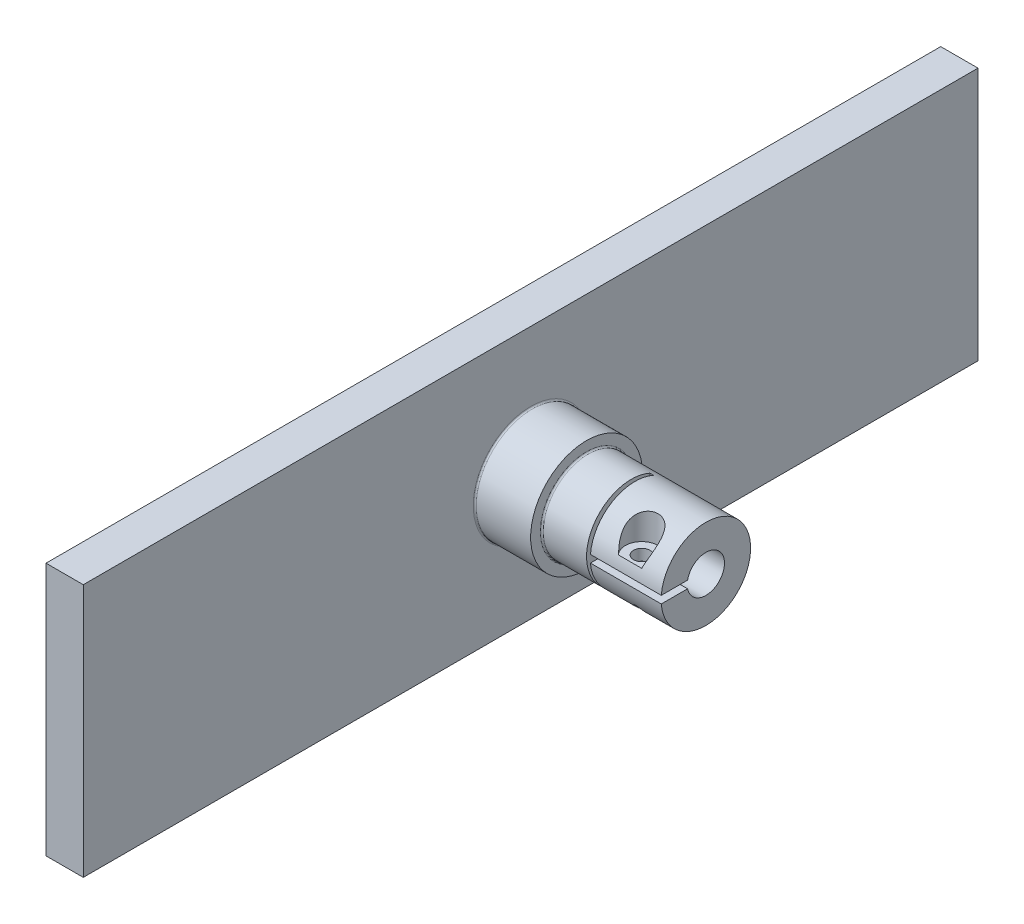
from build123d import *

# Parameters (mm, degrees)
SKETCH1_W                                     = 120
SKETCH1_H                                     = 34
BOSS_EXTRUDE1_DEPTH                           = 5
BOSS_EXTRUDE2_DEPTH                           = 7.5
SKETCH3_R                                     = 6
BOSS_EXTRUDE3_DEPTH                           = 16
CUT_EXTRUDE1_DEPTH                            = 9.5
SKETCH5_W                                     = 0.5
SKETCH5_H                                     = 12
CUT_EXTRUDE2_DEPTH                            = 8.5
CBORE_START                                   = 19
CBORE_FOR_M2_HEX_SOCKET_HEAD_CAP_SCREW1_DEPTH = 3.691221609
CBORE_START_2                                 = 17.5
CBORE_FOR_M2_HEX_SOCKET_HEAD_CAP_SCR_3_O_R    = 1.1
CBORE_FOR_M2_HEX_SOCKET_HEAD_CAP_SCR_3_DEPTH  = 1.5
M2_TAPPED_HOLE1_D                             = 1.6
FILLET1_R                                     = 0.2


# Read off the part's stored shape, not the designer's step: CBORE for M2 Hex Socket Head Cap Screw1
with BuildPart() as part:
    # Sketch1 → Boss-Extrude1 (new body)
    with BuildSketch(Plane(origin=(0, 0, 0), x_dir=(0, 0, -1), z_dir=(1, 0, 0))):
        with Locations((-60, 17)):
            Rectangle(SKETCH1_W, SKETCH1_H)
    extrude(amount=BOSS_EXTRUDE1_DEPTH)

    # Sketch2 → Boss-Extrude2 (add)
    with BuildSketch(Plane(origin=(5, 0, 0), x_dir=(0, 0, -1), z_dir=(1, 0, 0))):
        with BuildLine():
            ThreePointArc((-52.5, 17), (-54.696699141, 22.303300859), (-60, 24.5))
            Line((-60, 24.5), (-60, 9.5))
            ThreePointArc((-60, 9.5), (-54.696699141, 11.696699141), (-52.5, 17))
        make_face()
        with BuildLine():
            Line((-60, 9.5), (-60, 24.5))
            ThreePointArc((-60, 24.5), (-67.5, 17), (-60, 9.5))
        make_face()
    extrude(amount=BOSS_EXTRUDE2_DEPTH)

    # Sketch3 → Boss-Extrude3 (add)
    with BuildSketch(Plane(origin=(12.5, 0, 0), x_dir=(0, 0, -1), z_dir=(1, 0, 0))):
        with Locations((-60, 17)):
            Circle(SKETCH3_R)
    extrude(amount=BOSS_EXTRUDE3_DEPTH)

    # Sketch4 → Cut-Extrude1 (cut)
    with BuildSketch(Plane(origin=(28.5, 0, 0), x_dir=(0, 0, -1), z_dir=(1, 0, 0))):
        with BuildLine():
            Line((-62.449489743, 17.5), (-67.449489743, 17.5))
            Line((-67.449489743, 17.5), (-67.449489743, 16.5))
            Line((-67.449489743, 16.5), (-62.449489743, 16.5))
            ThreePointArc((-62.449489743, 16.5), (-57.5, 17), (-62.449489743, 17.5))
        make_face()
    extrude(amount=-CUT_EXTRUDE1_DEPTH, mode=Mode.SUBTRACT)

    # Sketch5 → Cut-Extrude2 (cut)
    with BuildSketch(Plane.XY.offset(66)):
        with Locations((18.75, 17)):
            Rectangle(SKETCH5_W, SKETCH5_H)
    extrude(amount=-CUT_EXTRUDE2_DEPTH, mode=Mode.SUBTRACT)

    # CBORE for M2 Hex Socket Head Cap Scr 2 → CBORE for M2 Hex Socket Head Cap Screw1 (cut)
    with BuildSketch(Plane(origin=(0, 0, 0), x_dir=(1, 0, 0), z_dir=(0, 1, 0)).offset(CBORE_START)):
        with BuildLine():
            Line((24.209160843, -67), (25.554414631, -65.656854249))
            ThreePointArc((25.554414631, -65.656854249), (24, -61.9), (22.445585369, -65.656854249))
            Line((22.445585369, -65.656854249), (23.790839157, -67))
            Line((23.790839157, -67), (24.209160843, -67))
        make_face()
    extrude(amount=CBORE_FOR_M2_HEX_SOCKET_HEAD_CAP_SCREW1_DEPTH, mode=Mode.SUBTRACT)

    # CBORE for M2 Hex Socket Head Cap Scr 3 o → CBORE for M2 Hex Socket Head Cap Scr 3 (cut)
    with BuildSketch(Plane(origin=(0, 0, 0), x_dir=(1, 0, 0), z_dir=(0, 1, 0)).offset(CBORE_START_2)):
        with Locations((24, -64.1)):
            Circle(CBORE_FOR_M2_HEX_SOCKET_HEAD_CAP_SCR_3_O_R)
    extrude(amount=CBORE_FOR_M2_HEX_SOCKET_HEAD_CAP_SCR_3_DEPTH, mode=Mode.SUBTRACT)

    # M2 Tapped Hole1 (through all)
    with Locations(Plane(origin=(0, 16.5, 0), x_dir=(1, 0, 0), z_dir=(0, 1, 0))):
        with Locations((24, -64.1)):
            Hole(M2_TAPPED_HOLE1_D / 2)

    # Fillet1
    fillet1_edges = [part.edges().sort_by_distance(p)[0] for p in [
        (5, 24.5, 60),
        (12.5, 17, 66),
    ]]
    fillet(fillet1_edges, radius=FILLET1_R)


solid = part.part
